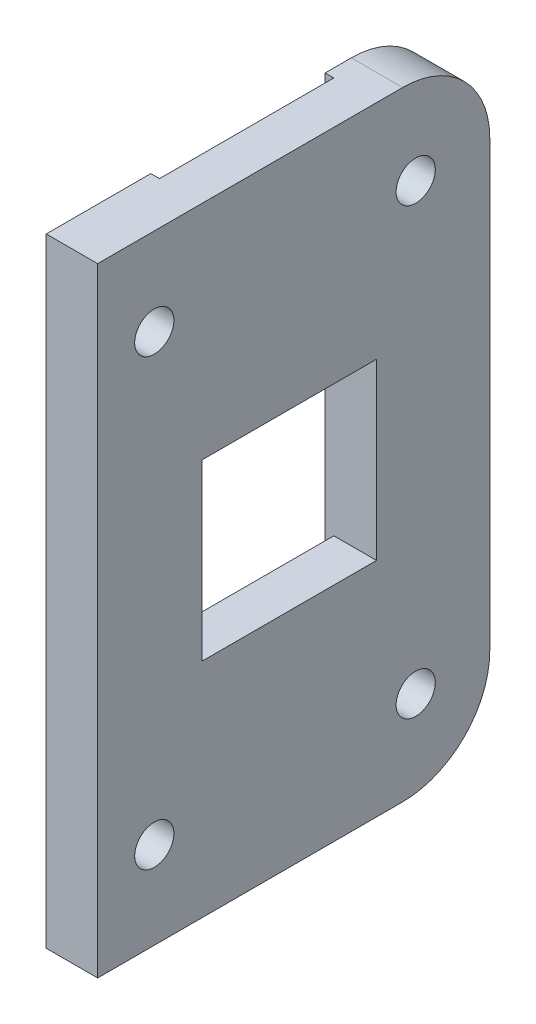
from build123d import *

# Parameters (mm, degrees)
SKETCH1_W           = 5.9
SKETCH1_H           = 45
BOSS_EXTRUDE1_DEPTH = 71
CUT_EXTRUDE2_REACH  = 77.438
SKETCH3_W           = 1
SKETCH3_H           = 20
FILLET1_R           = 10
CUT_EXTRUDE3_REACH  = 77.438
SKETCH4_R           = 2.25
CUT_EXTRUDE4_REACH  = 77.438
SKETCH5_W           = 20
SKETCH5_H           = 20


with BuildPart() as part:
    # Sketch1 → Boss-Extrude1 (new body)
    with BuildSketch(Plane(origin=(0, 0, 0), x_dir=(1, 0, 0), z_dir=(0, 1, 0))):
        with Locations((2.95, 2.3)):
            Rectangle(SKETCH1_W, SKETCH1_H)
    extrude(amount=BOSS_EXTRUDE1_DEPTH)

    # Sketch3 → Cut-Extrude2 (cut, up to next)
    with BuildSketch(Plane.XZ, mode=Mode.PRIVATE) as cut_extrude2_sk1:
        with Locations((0.5, -1.8)):
            Rectangle(SKETCH3_W, SKETCH3_H)
    cut_extrude2_tool1 = extrude(cut_extrude2_sk1.sketch, amount=-CUT_EXTRUDE2_REACH, mode=Mode.PRIVATE) & part.part
    add(cut_extrude2_tool1.solids().sort_by_distance((0.5, 0, -1.8))[0], mode=Mode.SUBTRACT)

    # Fillet1
    fillet1_edges = [part.edges().sort_by_distance(p)[0] for p in [
        (2.95, 0, -24.8),
        (2.95, 71, -24.8),
    ]]
    fillet(fillet1_edges, radius=FILLET1_R)

    # Sketch4 → Cut-Extrude3 (cut, up to next)
    with BuildSketch(Plane(origin=(5.9, 0, 0), x_dir=(0, 0, -1), z_dir=(1, 0, 0)), mode=Mode.PRIVATE) as cut_extrude3_sk1:
        with Locations((-13.7, 61)):
            Circle(SKETCH4_R)
    cut_extrude3_tool1 = extrude(cut_extrude3_sk1.sketch, amount=-CUT_EXTRUDE3_REACH, mode=Mode.PRIVATE) & part.part
    # Sketch4 → Cut-Extrude3 (cut, up to next)
    with BuildSketch(Plane(origin=(5.9, 0, 0), x_dir=(0, 0, -1), z_dir=(1, 0, 0)), mode=Mode.PRIVATE) as cut_extrude3_sk2:
        with Locations((-13.7, 10)):
            Circle(SKETCH4_R)
    cut_extrude3_tool2 = extrude(cut_extrude3_sk2.sketch, amount=-CUT_EXTRUDE3_REACH, mode=Mode.PRIVATE) & part.part
    # Sketch4 → Cut-Extrude3 (cut, up to next)
    with BuildSketch(Plane(origin=(5.9, 0, 0), x_dir=(0, 0, -1), z_dir=(1, 0, 0)), mode=Mode.PRIVATE) as cut_extrude3_sk3:
        with Locations((16.3, 10)):
            Circle(SKETCH4_R)
    cut_extrude3_tool3 = extrude(cut_extrude3_sk3.sketch, amount=-CUT_EXTRUDE3_REACH, mode=Mode.PRIVATE) & part.part
    # Sketch4 → Cut-Extrude3 (cut, up to next)
    with BuildSketch(Plane(origin=(5.9, 0, 0), x_dir=(0, 0, -1), z_dir=(1, 0, 0)), mode=Mode.PRIVATE) as cut_extrude3_sk4:
        with Locations((16.3, 61)):
            Circle(SKETCH4_R)
    cut_extrude3_tool4 = extrude(cut_extrude3_sk4.sketch, amount=-CUT_EXTRUDE3_REACH, mode=Mode.PRIVATE) & part.part
    add(cut_extrude3_tool1.solids().sort_by_distance((5.9, 61, 13.7))[0], mode=Mode.SUBTRACT)
    add(cut_extrude3_tool2.solids().sort_by_distance((5.9, 10, 13.7))[0], mode=Mode.SUBTRACT)
    add(cut_extrude3_tool3.solids().sort_by_distance((5.9, 10, -16.3))[0], mode=Mode.SUBTRACT)
    add(cut_extrude3_tool4.solids().sort_by_distance((5.9, 61, -16.3))[0], mode=Mode.SUBTRACT)

    # Sketch5 → Cut-Extrude4 (cut, up to next)
    with BuildSketch(Plane(origin=(5.9, 0, 0), x_dir=(0, 0, -1), z_dir=(1, 0, 0)), mode=Mode.PRIVATE) as cut_extrude4_sk1:
        with Locations((1.8, 35.5)):
            Rectangle(SKETCH5_W, SKETCH5_H)
    cut_extrude4_tool1 = extrude(cut_extrude4_sk1.sketch, amount=-CUT_EXTRUDE4_REACH, mode=Mode.PRIVATE) & part.part
    add(cut_extrude4_tool1.solids().sort_by_distance((5.9, 35.5, -1.8))[0], mode=Mode.SUBTRACT)


solid = part.part
